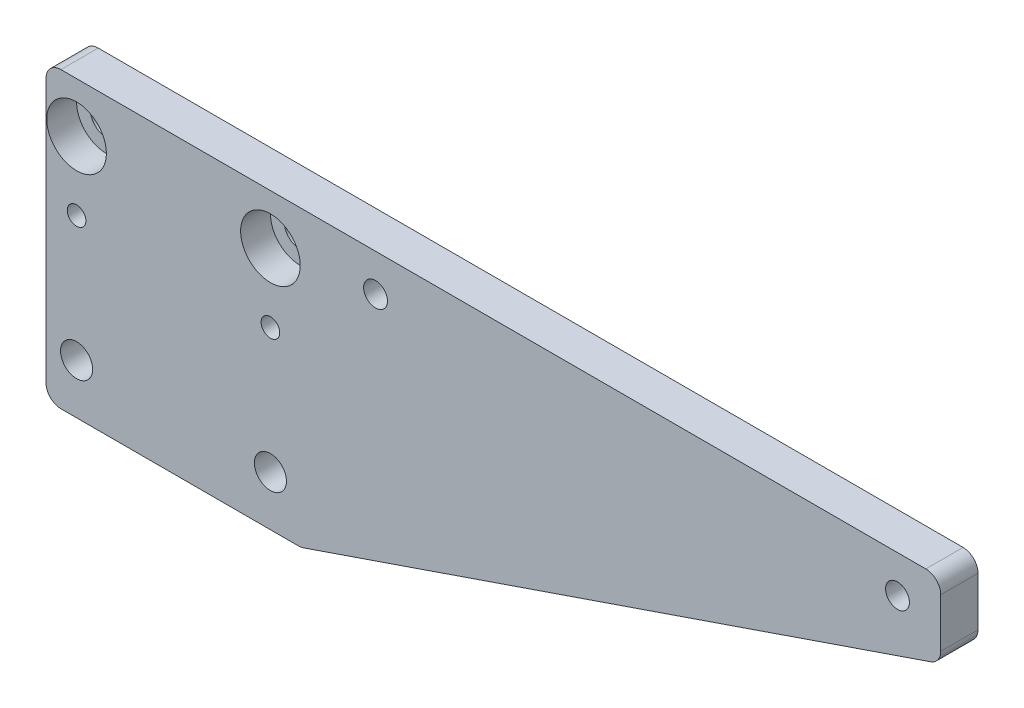
from build123d import *

# Parameters (mm, degrees)
BOSS_EXTRUDE1_DEPTH            = 5
CBORE_FOR_M4_SHCS1_D           = 4.3
CBORE_FOR_M4_SHCS1_CBORE_D     = 8
CBORE_FOR_M4_SHCS1_CBORE_DEPTH = 4
M4_CLEARANCE_HOLE1_D           = 4.3
TAP_DRILL_FOR_M3X0_5_TAP1_D    = 2.5
M3_CLEARANCE_HOLE2_D           = 3.2
FILLET1_R                      = 2


with BuildPart() as part:
    # Sketch1 → Boss-Extrude1 (new body)
    with BuildSketch(Plane.XY):
        Polygon((17.1, 19.7), (102.9, 19.7), (102.9, 9.7), (17.1, -19.7), (-17.1, -19.7), (-17.1, 19.7), align=None)
    extrude(amount=BOSS_EXTRUDE1_DEPTH)

    # CBORE for M4 SHCS1 (through all)
    with Locations(Plane.XY.offset(5)):
        with Locations((13, 13), (-13, 13)):
            CounterBoreHole(CBORE_FOR_M4_SHCS1_D / 2, CBORE_FOR_M4_SHCS1_CBORE_D / 2, CBORE_FOR_M4_SHCS1_CBORE_DEPTH)

    # M4 Clearance Hole1 (through all)
    with Locations(Plane.XY.offset(5)):
        with Locations((-13, -13), (13, -13)):
            Hole(M4_CLEARANCE_HOLE1_D / 2)

    # Tap Drill for M3x0.5 Tap1 (through all)
    with Locations(Plane.XY.offset(5)):
        with Locations((-13, 3.8), (13, 3.8)):
            Hole(TAP_DRILL_FOR_M3X0_5_TAP1_D / 2)

    # M3 Clearance Hole2 (through all)
    with Locations(Plane(origin=(0, 0, 0), x_dir=(-1, 0, 0), z_dir=(0, 0, -1))):
        with Locations((-97.1, 14.7), (-27.1, 14.7)):
            Hole(M3_CLEARANCE_HOLE2_D / 2)

    # Fillet1
    fillet1_edges = [part.edges().sort_by_distance(p)[0] for p in [
        (17.1, -19.7, 2.5),
        (-17.1, -19.7, 2.5),
        (102.9, 19.7, 2.5),
        (-17.1, 19.7, 2.5),
        (102.9, 9.7, 2.5),
    ]]
    fillet(fillet1_edges, radius=FILLET1_R)


solid = part.part
